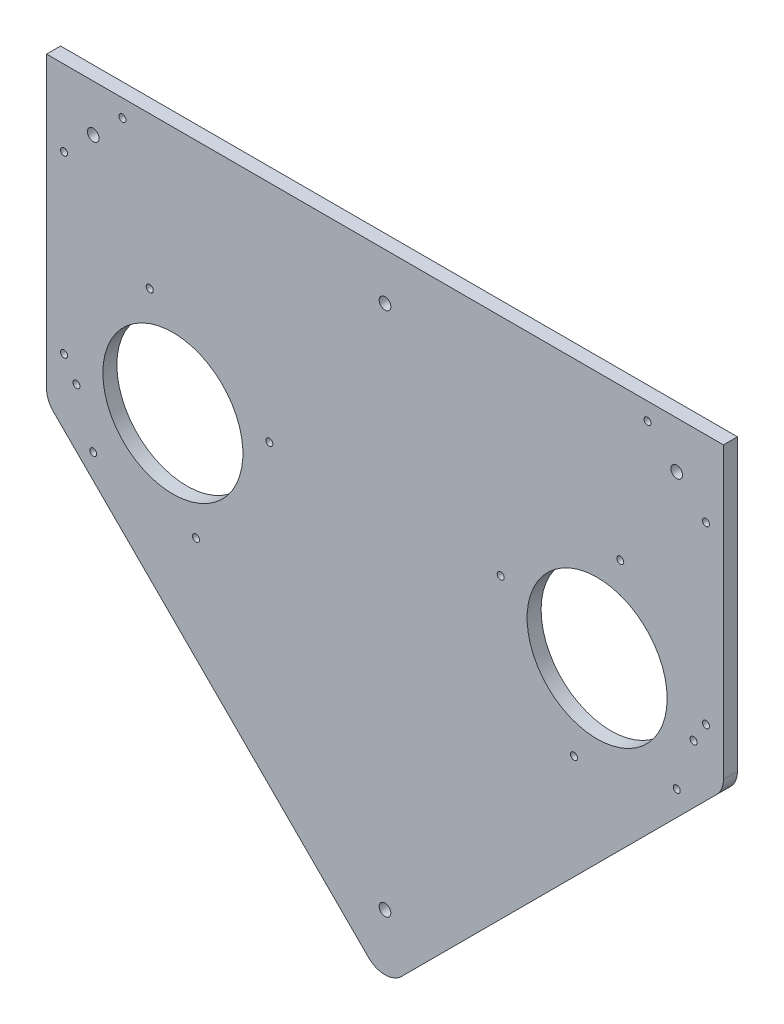
from build123d import *

# Parameters (mm, degrees)
SKETCH1_R           = 2.5
SKETCH1_R_2         = 1.5
BOSS_EXTRUDE1_DEPTH = 6
FILLET1_R           = 10
SKETCH2_R           = 1.5
SKETCH2_R_2         = 30
CUT_EXTRUDE1_DEPTH  = 10


with BuildPart() as part:
    # Sketch1 → Boss-Extrude1 (new body)
    with BuildSketch(Plane.XY):
        Polygon((-145, 120), (145, 120), (145, -8.284271247), (0, -153.284271247), (-145, -8.284271247), align=None)
        with Locations((0, -125)):
            Circle(SKETCH1_R, mode=Mode.SUBTRACT)
        with Locations((-137.515790027, 87.484209973)):
            Circle(SKETCH1_R_2, mode=Mode.SUBTRACT)
        with Locations((-112.484209973, 112.515790027)):
            Circle(SKETCH1_R_2, mode=Mode.SUBTRACT)
        with Locations((-137.515790027, 12.515790027)):
            Circle(SKETCH1_R_2, mode=Mode.SUBTRACT)
        with Locations((-125, -17.7)):
            Circle(SKETCH1_R_2, mode=Mode.SUBTRACT)
        with Locations((125, -17.7)):
            Circle(SKETCH1_R_2, mode=Mode.SUBTRACT)
        with Locations((137.515790027, 12.515790027)):
            Circle(SKETCH1_R_2, mode=Mode.SUBTRACT)
        with Locations((137.515790027, 87.484209973)):
            Circle(SKETCH1_R_2, mode=Mode.SUBTRACT)
        with Locations((112.484209973, 112.515790027)):
            Circle(SKETCH1_R_2, mode=Mode.SUBTRACT)
        with Locations((0, 100)):
            Circle(SKETCH1_R, mode=Mode.SUBTRACT)
        with Locations((-125, 100)):
            Circle(SKETCH1_R, mode=Mode.SUBTRACT)
        with Locations((125, 100)):
            Circle(SKETCH1_R, mode=Mode.SUBTRACT)
    extrude(amount=BOSS_EXTRUDE1_DEPTH)

    # Fillet1
    fillet1_edges = [part.edges().sort_by_distance(p)[0] for p in [
        (-145, -8.284271247, 3),
        (145, -8.284271247, 3),
        (0, -153.284271247, 3),
    ]]
    fillet(fillet1_edges, radius=FILLET1_R)

    # Sketch2 → Cut-Extrude1 (cut)
    with BuildSketch(Plane.XY.offset(6)):
        with Locations((49.555354063, 23.709258675)):
            Circle(SKETCH2_R)
        with Locations((100.801698291, 55.114866507)):
            Circle(SKETCH2_R)
        with Locations((132.207306124, 3.86852228)):
            Circle(SKETCH2_R)
        with Locations((80.960961896, -27.537085553)):
            Circle(SKETCH2_R)
        with Locations((90.881330093, 13.788890477)):
            Circle(SKETCH2_R_2)
        with Locations((-49.555354063, 23.709258675)):
            Circle(SKETCH2_R)
        with Locations((-100.801698291, 55.114866507)):
            Circle(SKETCH2_R)
        with Locations((-80.960961896, -27.537085553)):
            Circle(SKETCH2_R)
        with Locations((-132.207306124, 3.86852228)):
            Circle(SKETCH2_R)
        with Locations((-90.881330093, 13.788890477)):
            Circle(SKETCH2_R_2)
    extrude(amount=-CUT_EXTRUDE1_DEPTH, mode=Mode.SUBTRACT)


solid = part.part
